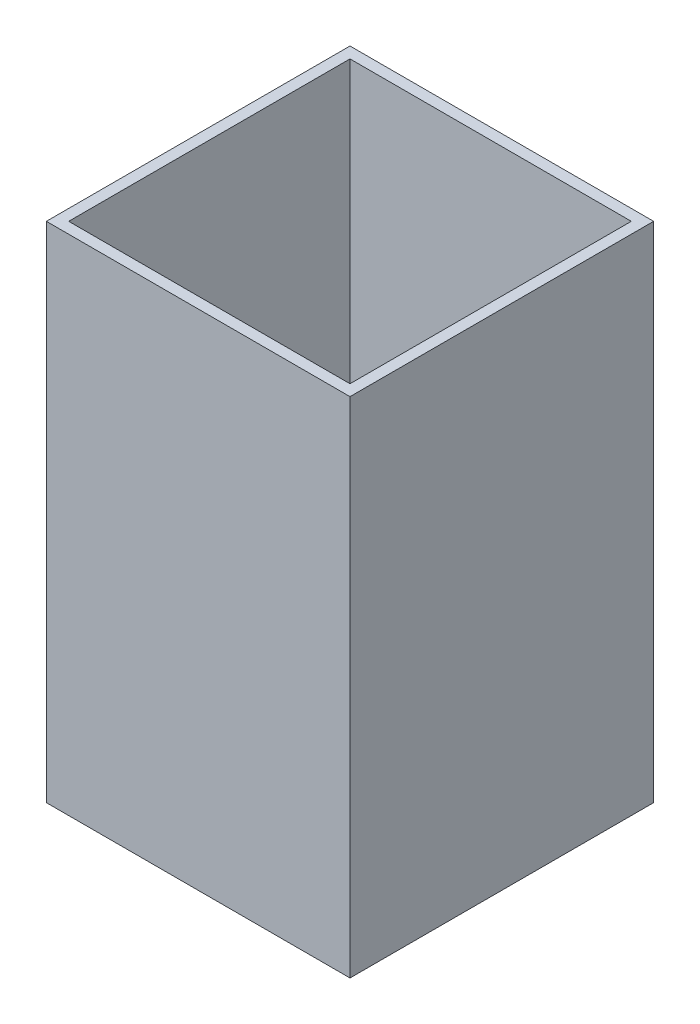
from build123d import *

# Parameters (mm, degrees)
SKETCH1_W           = 86.35
SKETCH1_H           = 86.35
SKETCH1_W_2         = 80
SKETCH1_H_2         = 80
BOSS_EXTRUDE1_DEPTH = 140
SKETCH2_W           = 86.35
SKETCH2_H           = 86.35
BOSS_EXTRUDE2_DEPTH = 3.175


with BuildPart() as part:
    # Sketch1 → Boss-Extrude1 (new body)
    with BuildSketch(Plane(origin=(0, 0, 0), x_dir=(1, 0, 0), z_dir=(0, 1, 0))):
        with Locations((43.175, 43.175)):
            Rectangle(SKETCH1_W, SKETCH1_H)
        with Locations((43.175, 43.175)):
            Rectangle(SKETCH1_W_2, SKETCH1_H_2, mode=Mode.SUBTRACT)
    extrude(amount=BOSS_EXTRUDE1_DEPTH)

    # Sketch2 → Boss-Extrude2 (add)
    with BuildSketch(Plane.XZ):
        with Locations((43.175, -43.175)):
            Rectangle(SKETCH2_W, SKETCH2_H)
    extrude(amount=BOSS_EXTRUDE2_DEPTH)


solid = part.part
